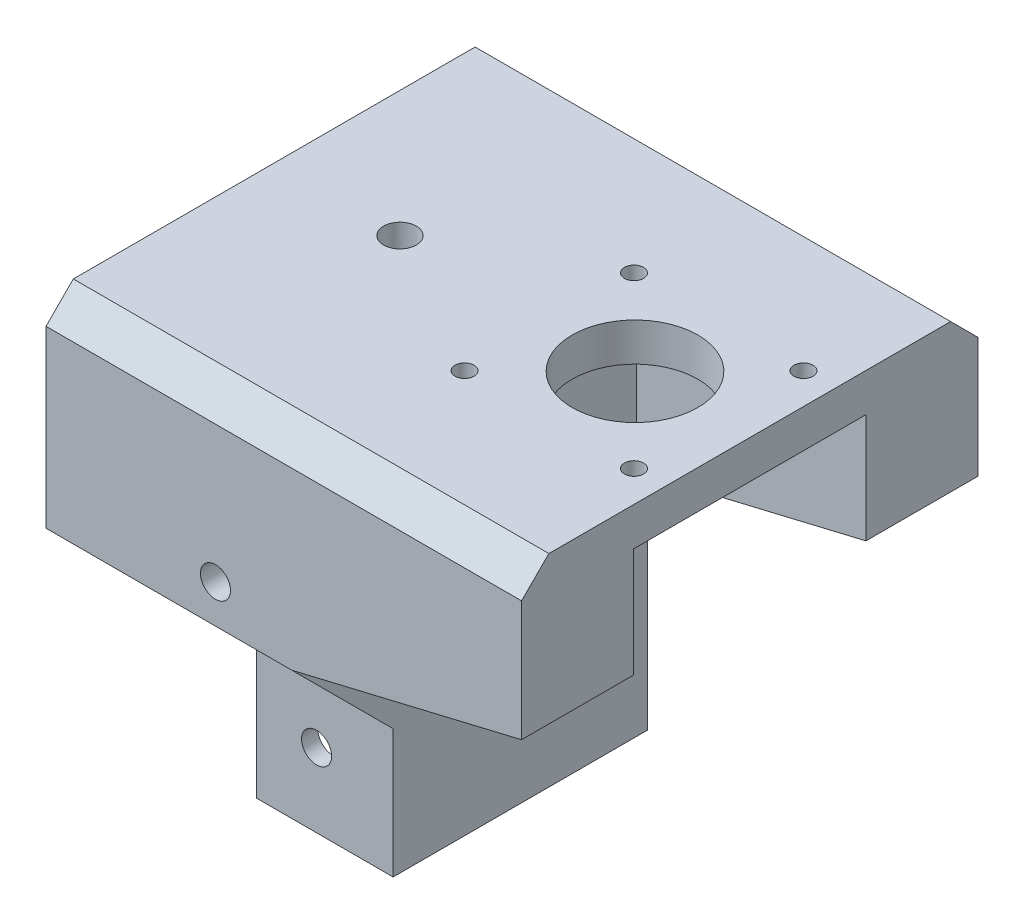
from build123d import *

# Parameters (mm, degrees)
BOSS_EXTRUDE1_DEPTH      = 75
SKETCH4_R                = 3
CUT_EXTRUDE1_DEPTH       = 3
BOSS_EXTRUDE2_DEPTH      = 4
BOSS_EXTRUDE2_DEPTH_BACK = 3
SKETCH2_R                = 3
SKETCH8_W                = 20.001838136
SKETCH8_H                = 30
BOSS_EXTRUDE6_DEPTH      = 3
SKETCH9_W                = 39.501838136
SKETCH9_H                = 30
BOSS_EXTRUDE7_DEPTH      = 3
SKETCH10_R               = 4.05
BOSS_EXTRUDE8_DEPTH      = 45.001838136
SKETCH11_R               = 4.05
BOSS_EXTRUDE9_DEPTH      = 42
SKETCH12_R               = 11.5
SKETCH12_R_2             = 1.75
CUT_EXTRUDE2_DEPTH       = 42
CUT_EXTRUDE3_START       = -5.5
SKETCH13_R               = 4.05
CUT_EXTRUDE3_DEPTH       = 5.5
SKETCH14_W               = 47.5
SKETCH14_H               = 18.5
BOSS_EXTRUDE11_DEPTH     = 7
CHAMFER1_START           = 96.166522241
CHAMFER1_OUTLINE_W       = 47.5
CHAMFER1_OUTLINE_H       = 10
CHAMFER1_DEPTH           = 4.833477759
SKETCH17_W               = 45
SKETCH17_H               = 18.5
BOSS_EXTRUDE12_DEPTH     = 30
CUT_EXTRUDE5_DEPTH       = 111.611934257
CUT_EXTRUDE5_DEPTH_BACK  = 111.611934257
SKETCH19_R               = 2.75
CUT_EXTRUDE6_DEPTH       = 22
BOSS_EXTRUDE13_START     = -22
SKETCH20_R               = 4.05
BOSS_EXTRUDE13_DEPTH     = 22
SKETCH22_W               = 1
SKETCH22_H               = 10
CUT_EXTRUDE_THIN1_DEPTH  = 51
CHAMFER2_SIZE            = 18.5


with BuildPart() as part:
    # Sketch1 → Boss-Extrude1 (new body)
    with BuildSketch(Plane(origin=(0, 0, 0), x_dir=(1, 0, 0), z_dir=(0, 1, 0))):
        Polygon((0, 0), (0, 40.5), (3, 40.5), (3, -3), (-22, -3), (-22, 0), align=None)
    extrude(amount=BOSS_EXTRUDE1_DEPTH)

    # Sketch4 → Cut-Extrude1 (cut)
    with BuildSketch(Plane(origin=(3, 0, 0), x_dir=(0, 0, -1), z_dir=(1, 0, 0))):
        with Locations((20.25, 27)):
            Circle(SKETCH4_R)
    extrude(amount=-CUT_EXTRUDE1_DEPTH, mode=Mode.SUBTRACT)

    # Sketch2 → Boss-Extrude2 (add, two sides: drawn at the far end of the back side and taken through both)
    with BuildSketch(Plane(origin=(0, 75, 0), x_dir=(1, 0, 0), z_dir=(0, 1, 0)).offset(-BOSS_EXTRUDE2_DEPTH_BACK)):
        Polygon((-0.001838136, 40.5), (-42.001838136, 40.5), (-42.001838136, 0), (-42.001838136, -3), (3, -3), (3, 40.5), align=None)
        with Locations(Location((-19.001838136, 20.25, 0), (0, 0, 270))):
            Circle(SKETCH2_R, mode=Mode.SUBTRACT)
    extrude(amount=BOSS_EXTRUDE2_DEPTH + BOSS_EXTRUDE2_DEPTH_BACK)

    # Sketch8 → Boss-Extrude6 (add)
    with BuildSketch(Plane.XY.offset(3)):
        with Locations((-32.000919068, 57)):
            Rectangle(SKETCH8_W, SKETCH8_H)
    extrude(amount=-BOSS_EXTRUDE6_DEPTH)

    # Sketch9 → Boss-Extrude7 (add)
    with BuildSketch(Plane(origin=(0, 0, -40.5), x_dir=(-1, 0, 0), z_dir=(0, 0, -1))):
        Polygon((42.001838136, 79), (-3, 79), (-3, 0), (0, 0), (0, 72), (42.001838136, 72), align=None)
        with Locations((22.250919068, 57)):
            Rectangle(SKETCH9_W, SKETCH9_H)
    extrude(amount=BOSS_EXTRUDE7_DEPTH)

    # Sketch10 → Boss-Extrude8 (add)
    with BuildSketch(Plane.ZY.offset(42.001838136)):
        Polygon((3, 79), (16.5, 79), (21.5, 74), (21.5, 42), (3, 42), align=None)
        with Locations((11.5, 62)):
            Circle(SKETCH10_R, mode=Mode.SUBTRACT)
    boss_extrude8 = extrude(amount=-BOSS_EXTRUDE8_DEPTH)

    # Sketch11 → Boss-Extrude9 (add)
    with BuildSketch(Plane(origin=(3, 0, 0), x_dir=(0, 0, -1), z_dir=(1, 0, 0))):
        Polygon((-1, 42), (-1, 72), (41.5, 72), (41.5, 42), (43.5, 42), (43.5, 79), (-16.5, 79), (-21.5, 74), (-21.5, 42), (-3, 42), align=None)
        with Locations(Location((-11.5, 62, 0), (0, 0, 180))):
            Circle(SKETCH11_R, mode=Mode.SUBTRACT)
    extrude(amount=BOSS_EXTRUDE9_DEPTH)

    # Mirror3: Boss-Extrude8 across plane
    add(boss_extrude8.mirror(Plane.XY.offset(-20.25)))

    # Sketch12 → Cut-Extrude2 (cut)
    with BuildSketch(Plane.XZ.offset(-72)):
        with Locations(Location((24, -20.25, 0), (0, 0, 270))):
            Circle(SKETCH12_R)
        with Locations(Location((39.317647059, -4.75, 0), (0, 0, 270))):
            Circle(SKETCH12_R_2)
        with Locations(Location((8.317647059, -4.75, 0), (0, 0, 270))):
            Circle(SKETCH12_R_2)
        with Locations(Location((8.317647059, -35.75, 0), (0, 0, 270))):
            Circle(SKETCH12_R_2)
        with Locations(Location((39.317647059, -35.75, 0), (0, 0, 270))):
            Circle(SKETCH12_R_2)
    extrude(amount=-CUT_EXTRUDE2_DEPTH, mode=Mode.SUBTRACT)

    # Sketch13 → Cut-Extrude3 (cut)
    with BuildSketch(Plane(origin=(3, 0, 0), x_dir=(0, 0, -1), z_dir=(1, 0, 0)).offset(CUT_EXTRUDE3_START)):
        Polygon((43.5, 42), (62, 42), (62, 74), (57, 79), (43.5, 79), align=None)
        with Locations(Location((52, 62, 0), (0, 0, 270))):
            Circle(SKETCH13_R, mode=Mode.SUBTRACT)
    extrude(amount=CUT_EXTRUDE3_DEPTH, mode=Mode.SUBTRACT)

    # Sketch14 → Boss-Extrude11 (add)
    with BuildSketch(Plane(origin=(0, 79, 0), x_dir=(1, 0, 0), z_dir=(0, 1, 0))):
        with Locations((21.25, 52.75)):
            Rectangle(SKETCH14_W, SKETCH14_H)
    extrude(amount=-BOSS_EXTRUDE11_DEPTH)

    # Chamfer1: read off the stored shape, not the designer's step
    # Chamfer1 outline → Chamfer1 (cut)
    with BuildSketch(Plane(origin=(0, 0, 0), x_dir=(1, 0, 0), z_dir=(0, 0.7071067811865466, -0.7071067811865486)).offset(CHAMFER1_START)):
        with Locations((21.25, -12)):
            Rectangle(CHAMFER1_OUTLINE_W, CHAMFER1_OUTLINE_H)
    extrude(amount=CHAMFER1_DEPTH, mode=Mode.SUBTRACT)

    # Sketch17 → Boss-Extrude12 (add)
    with BuildSketch(Plane(origin=(0, 72, 0), x_dir=(-1, 0, 0), z_dir=(0, -1, 0))):
        with Locations((-22.5, 52.75)):
            Rectangle(SKETCH17_W, SKETCH17_H)
    extrude(amount=BOSS_EXTRUDE12_DEPTH)

    # Sketch18 → Cut-Extrude5 (cut, two sides: drawn at the far end of the back side and taken through both)
    with BuildSketch(Plane(origin=(0, 0, 1), x_dir=(-1, 0, 0), z_dir=(0, 0, -1)).offset(-CUT_EXTRUDE5_DEPTH_BACK)):
        Polygon((-45, 52), (-45, 42), (-3, 42), align=None)
    extrude(amount=CUT_EXTRUDE5_DEPTH + CUT_EXTRUDE5_DEPTH_BACK, mode=Mode.SUBTRACT)

    # Sketch19 → Cut-Extrude6 (cut)
    with BuildSketch(Plane(origin=(0, 0, 0), x_dir=(-1, 0, 0), z_dir=(0, 0, -1))):
        with Locations((11, 49)):
            Circle(SKETCH19_R)
        with Locations((11, 13.5)):
            Circle(SKETCH19_R)
    extrude(amount=-CUT_EXTRUDE6_DEPTH, mode=Mode.SUBTRACT)

    # Sketch20 → Boss-Extrude13 (add)
    with BuildSketch(Plane(origin=(45, 0, 0), x_dir=(0, 0, -1), z_dir=(1, 0, 0)).offset(BOSS_EXTRUDE13_START)):
        with Locations(Location((-11.5, 62, 0), (0, 0, 180))):
            Circle(SKETCH20_R)
    extrude(amount=BOSS_EXTRUDE13_DEPTH)

    # Sketch22 → Cut-Extrude-Thin1 (cut)
    with BuildSketch(Plane.ZY.offset(42.001838136)):
        with Locations((-52, 57)):
            Rectangle(SKETCH22_W, SKETCH22_H)
        with Locations((11.5, 57)):
            Rectangle(SKETCH22_W, SKETCH22_H)
    extrude(amount=-CUT_EXTRUDE_THIN1_DEPTH, mode=Mode.SUBTRACT)

    # Chamfer2
    chamfer2_edges = [part.edges().sort_by_distance(p)[0] for p in [
        (-9.5, 42, 3),
    ]]
    chamfer(chamfer2_edges, length=CHAMFER2_SIZE - 0.0001)  # a hair under: the kernel refuses the full size


solid = part.part
